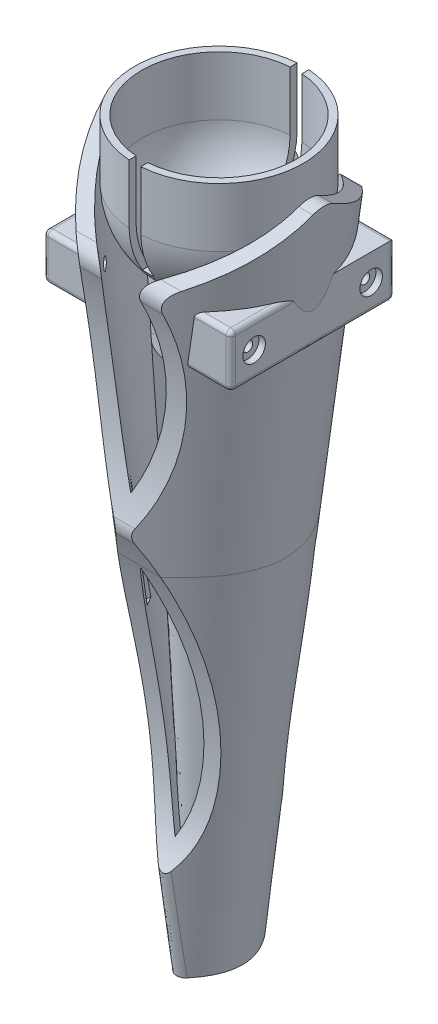
from build123d import *

# Parameters (mm, degrees)
SHELL1_T                                = -7.62
CUT_EXTRUDE3_DEPTH                      = 393.725810971
BOSS_EXTRUDE2_REACH                     = 413.424
SKETCH13_W                              = 88.9
SKETCH13_H                              = 28.61648991
BOSS_EXTRUDE4_REACH                     = 413.424
SKETCH14_W                              = 88.9
SKETCH14_H                              = 24.853940758
FILLET2_R                               = 2.54
SKETCH7_R                               = 28.575
SKETCH9_R                               = 12.7
CUT_EXTRUDE6_DEPTH                      = 18.415
CUT_EXTRUDE7_DEPTH                      = 402.110839605
CUT_EXTRUDE7_DEPTH_BACK                 = 402.110839605
SKETCH28_W                              = 6.35
SKETCH28_H                              = 76.2
FILLET3_R                               = 10
FILLET4_R                               = 5.08
M5_TAPPED_HOLE1_D                       = 4.2
M5_TAPPED_HOLE1_DEPTH                   = 36.83
M5_TAPPED_HOLE1_TIP                     = 1.2618073
M5_TAPPED_HOLE3_AT_2_COUNT              = 2
M5_TAPPED_HOLE3_AT_2_PITCH              = 35.56
CBORE_FOR_M5_HEX_HEAD_BOLT1_D           = 5.5
CBORE_FOR_M5_HEX_HEAD_BOLT1_DEPTH       = 109.22
CBORE_FOR_M5_HEX_HEAD_BOLT1_CBORE_D     = 12.238
CBORE_FOR_M5_HEX_HEAD_BOLT1_CBORE_DEPTH = 3.5
CBORE_FOR_M5_HEX_HEAD_BOLT1_TIP         = 1.652366702


with BuildPart() as part:
    # Sketch2 → Loft1 section 0
    with BuildSketch(Plane(origin=(0, 381, 0), x_dir=(1, 0, 0), z_dir=(0, 1, 0))):
        with BuildLine():
            add(Edge.make_bspline(
                [(0, 76.2), (-114.3, 0), (0, -76.2)],
                knots=[0, 0, 0, 1, 1, 1], degree=2))
            add(Edge.make_bspline(
                [(0, 76.2), (114.3, 0), (0, -76.2)],
                knots=[0, 0, 0, 1, 1, 1], degree=2))
        make_face()
    # Sketch1 → Loft1 section 1
    with BuildSketch(Plane(origin=(0, 0, 0), x_dir=(1, 0, 0), z_dir=(0, 1, 0))):
        with BuildLine():
            add(Edge.make_bspline(
                [(0, 25.4), (-25.4, 0), (0, -25.4)],
                knots=[0, 0, 0, 1, 1, 1], degree=2))
            add(Edge.make_bspline(
                [(0, 25.4), (25.4, 0), (0, -25.4)],
                knots=[0, 0, 0, 1, 1, 1], degree=2))
        make_face()
    loft()

    # Shell1
    shell1_openings = [part.faces().sort_by_distance(p)[0] for p in [
        (0, 381, 0),
    ]]
    offset(amount=SHELL1_T, openings=shell1_openings)

    # Sketch3 → Cut-Extrude3 (cut, symmetric)
    with BuildSketch(Plane(origin=(0, 0, 0), x_dir=(0, 0, -1), z_dir=(1, 0, 0))):
        with BuildLine():
            Line((0, 459.130125037), (-203.7464305, 459.130125037))
            Line((-203.7464305, 459.130125037), (-203.7464305, 12.906431939))
            Line((-203.7464305, 12.906431939), (-69.701984492, 12.906431939))
            Line((-69.701984492, 12.906431939), (-69.701984492, 27.061813336))
            add(Edge.make_bspline(
                [(-52.768571482, 223.149081543), (-29.06462861, 178.241076219), (18.494577431, 46.178312345), (-69.701984492, 27.061813336)],
                knots=[0, 0, 0, 0, 1, 1, 1, 1], degree=3))
            ThreePointArc((-52.768571482, 223.149081543), (-42.80728918, 284.07818925), (-55.919411696, 344.407747133))
            Line((-55.919411696, 344.407747133), (0, 380.371467579))
            Line((0, 380.371467579), (0, 459.130125037))
        make_face()
    cut_extrude3 = extrude(amount=CUT_EXTRUDE3_DEPTH, both=True, mode=Mode.SUBTRACT)

    # Mirror1: Cut-Extrude3 across plane
    add(cut_extrude3.mirror(Plane.XY), mode=Mode.SUBTRACT)

    # Sketch13 → Boss-Extrude2 (add, up to next)
    with BuildSketch(Plane(origin=(50.8, 0, 0), x_dir=(0, 0, -1), z_dir=(1, 0, 0)), mode=Mode.PRIVATE) as boss_extrude2_sk1:
        with Locations((0, 323.85)):
            Rectangle(SKETCH13_W, SKETCH13_H)
    boss_extrude2_tool1 = extrude(boss_extrude2_sk1.sketch, amount=-BOSS_EXTRUDE2_REACH, mode=Mode.PRIVATE) - part.part
    add(boss_extrude2_tool1.solids().sort_by_distance((50.8, 323.85, 0))[0])

    # Sketch14 → Boss-Extrude4 (add, up to next)
    with BuildSketch(Plane(origin=(-50.8, 0, 0), x_dir=(0, 0, -1), z_dir=(1, 0, 0)), mode=Mode.PRIVATE) as boss_extrude4_sk1:
        with Locations((0, 323.85)):
            Rectangle(SKETCH14_W, SKETCH14_H)
    boss_extrude4_tool1 = extrude(boss_extrude4_sk1.sketch, amount=BOSS_EXTRUDE4_REACH, mode=Mode.PRIVATE) - part.part
    add(boss_extrude4_tool1.solids().sort_by_distance((-50.8, 323.85, 0))[0])

    # Fillet2
    fillet2_edges = [part.edges().sort_by_distance(p)[0] for p in [
        (38.958323486, 309.541755045, 44.45),
        (41.106457576, 338.158244955, 44.45),
        (50.8, 323.85, 44.45),
        (50.8, 338.158244955, 27.899199178),
        (50.8, 309.541755045, 0),
        (38.958323486, 309.541755045, -44.45),
        (41.106457576, 338.158244955, -44.45),
        (50.8, 323.85, -44.45),
        (-40.966471989, 336.276970379, 44.45),
        (-39.100820832, 311.423029621, 44.45),
        (-50.8, 323.85, 44.45),
        (-50.8, 311.423029621, 0),
        (-50.8, 336.276970379, 27.410611472),
        (-39.100820832, 311.423029621, -44.45),
        (-50.8, 323.85, -44.45),
        (-40.966471989, 336.276970379, -44.45),
        (-50.8, 336.276970379, -27.410611472),
    ]]
    fillet(fillet2_edges, radius=FILLET2_R)



with BuildPart() as body_2:
    # Sketch4 → Revolve1 (revolve)
    with BuildSketch(Plane.XY, mode=Mode.PRIVATE) as revolve1_sk:
        with BuildLine():
            Line((0, 380.371467579), (0, 393.071467579))
            Line((0, 393.071467579), (45.72, 393.071467579))
            Line((45.72, 393.071467579), (45.72, 361.093443321))
            ThreePointArc((45.72, 361.093443321), (31.857721151, 329.679935512), (0, 316.871467579))
            Line((0, 316.871467579), (0, 380.371467579))
        make_face()
    revolve(revolve1_sk.sketch.rotate(Axis((0, 446.903028638, 0), (0, -1, 0)), 90), axis=Axis((0, 446.903028638, 0), (0, -1, 0)))


with BuildPart() as part_1:
    add(part.part)

    add(body_2.part)  # Loft2 merges body 2
    # Sketch7 → Loft2 section 0
    with BuildSketch(Plane(origin=(0, 342.9, 0), x_dir=(1, 0, 0), z_dir=(0, 1, 0))):
        Circle(SKETCH7_R)
    # Sketch9 → Loft2 section 1
    with BuildSketch(Plane(origin=(0, 7.62, 0), x_dir=(1, 0, 0), z_dir=(0, 1, 0))):
        Circle(SKETCH9_R)
    loft()

    # Sketch11 → Cut-Revolve2 (revolve, cut)
    with BuildSketch(Plane.XY, mode=Mode.PRIVATE) as cut_revolve2_sk:
        with BuildLine():
            Line((-41.91, 393.071467579), (-41.91, 361.093443321))
            ThreePointArc((-41.91, 361.093443321), (-29.304872567, 332.02262726), (0, 319.971651041))
            Line((0, 319.971651041), (0, 393.071467579))
            Line((0, 393.071467579), (-41.91, 393.071467579))
        make_face()
    revolve(cut_revolve2_sk.sketch.rotate(Axis((0, 0, 0), (0, 1, 0)), 90), axis=Axis((0, 0, 0), (0, 1, 0)), mode=Mode.SUBTRACT)

    # Sketch12 → Cut-Extrude6 (cut, symmetric)
    with BuildSketch(Plane(origin=(0, 0, 0), x_dir=(0, 0, -1), z_dir=(1, 0, 0))):
        with BuildLine():
            Line((-4.170962725, 269.24175627), (-4.170962725, 173.919006329))
            ThreePointArc((-4.170962725, 173.919006329), (-13.977038107, 166.959837487), (-25.831855986, 168.972904406))
            Line((-25.831855986, 168.972904406), (-33.811932191, 288.676964156))
            ThreePointArc((-33.811932191, 288.676964156), (-14.966284111, 285.09820599), (-4.170962725, 269.24175627))
        make_face()
    cut_extrude6 = extrude(amount=CUT_EXTRUDE6_DEPTH, both=True, mode=Mode.SUBTRACT)

    # Mirror2: Cut-Extrude6 across plane
    add(cut_extrude6.mirror(Plane.XY), mode=Mode.SUBTRACT)

    # Mirror2 at the second plane: Cut-Extrude6 across plane
    add(cut_extrude6.mirror(Plane(origin=(0, 0, 0), x_dir=(0, 0, 1), z_dir=(1, 0, 0))), mode=Mode.SUBTRACT)

    # Sketch28 → Cut-Extrude7 (cut, two sides: drawn at the far end of the back side and taken through both)
    with BuildSketch(Plane.XY.offset(-CUT_EXTRUDE7_DEPTH_BACK)):
        with Locations((0, 375.958391147)):
            Rectangle(SKETCH28_W, SKETCH28_H)
    extrude(amount=CUT_EXTRUDE7_DEPTH + CUT_EXTRUDE7_DEPTH_BACK, mode=Mode.SUBTRACT)

    # Fillet3
    fillet3_edges = [part_1.edges().sort_by_distance(p)[0] for p in [
        (53.240829687, 380.371467579, 0),
        (14.312359211, 344.407747133, 55.919411696),
        (-1.638525636, 223.149081543, 52.768571482),
        (-53.240829687, 380.371467579, 0),
        (14.312359211, 344.407747133, -55.919411696),
        (-14.312359211, 344.407747133, -55.919411696),
        (1.638525636, 223.149081543, -52.768571482),
        (-14.312359211, 344.407747133, 55.919411696),
    ]]
    fillet(fillet3_edges, radius=FILLET3_R)

    # Fillet4
    fillet4_edges = [part_1.edges().sort_by_distance(p)[0] for p in [
        (0, 25.047325609, 28.739643415),
        (0, 25.047325609, -28.739643415),
    ]]
    fillet(fillet4_edges, radius=FILLET4_R)

    # M5 Tapped Hole1
    with Locations(Plane.XZ):
        with Locations((0, -17.78), (0, 17.78)):
            Hole(M5_TAPPED_HOLE1_D / 2, depth=M5_TAPPED_HOLE1_DEPTH)
            with Locations((0, 0, -(M5_TAPPED_HOLE1_DEPTH + M5_TAPPED_HOLE1_TIP / 2))):  # 118° drill point
                Cone(0, M5_TAPPED_HOLE1_D / 2, M5_TAPPED_HOLE1_TIP, mode=Mode.SUBTRACT)

    # Sketch40 → M5 Tapped Hole3 (revolve, cut)
    with BuildSketch(Plane(origin=(0, 279.4, -17.78), x_dir=(0, 0, -1), z_dir=(1, 0, 0))):
        Polygon((0, 0), (0, 113.671467579), (2.1, 113.671467579), (2.1, 0.425), (2.525, 0), align=None)
    m5_tapped_hole3 = revolve(axis=Axis((0, 273.05, -17.78), (0, 1, 0)), mode=Mode.SUBTRACT)

    # M5 Tapped Hole3 at 2: M5 Tapped Hole3 ×2
    with Locations(*[(0, 0, i * M5_TAPPED_HOLE3_AT_2_PITCH) for i in range(1, M5_TAPPED_HOLE3_AT_2_COUNT)]):
        add(m5_tapped_hole3, mode=Mode.SUBTRACT)

    # CBORE for M5 Hex Head Bolt1
    with Locations(Plane(origin=(50.8, 0, 0), x_dir=(0, 0, -1), z_dir=(1, 0, 0))):
        with Locations((31.75, 323.85), (-31.75, 323.85)):
            CounterBoreHole(CBORE_FOR_M5_HEX_HEAD_BOLT1_D / 2, CBORE_FOR_M5_HEX_HEAD_BOLT1_CBORE_D / 2, CBORE_FOR_M5_HEX_HEAD_BOLT1_CBORE_DEPTH, depth=CBORE_FOR_M5_HEX_HEAD_BOLT1_DEPTH)
            with Locations((0, 0, -(CBORE_FOR_M5_HEX_HEAD_BOLT1_DEPTH + CBORE_FOR_M5_HEX_HEAD_BOLT1_TIP / 2))):  # 118° drill point
                Cone(0, CBORE_FOR_M5_HEX_HEAD_BOLT1_D / 2, CBORE_FOR_M5_HEX_HEAD_BOLT1_TIP, mode=Mode.SUBTRACT)


with BuildPart() as body_2_2:
    # Split1: the piece on the far side of the plane
    add(part_1.part)
    split(bisect_by=Plane.ZX.offset(203.2), keep=Keep.BOTTOM)


with BuildPart() as part_2:
    add(part_1.part)

    # Split1
    split(bisect_by=Plane.ZX.offset(203.2), keep=Keep.TOP)


solid = Compound([body_2_2.part, part_2.part])
